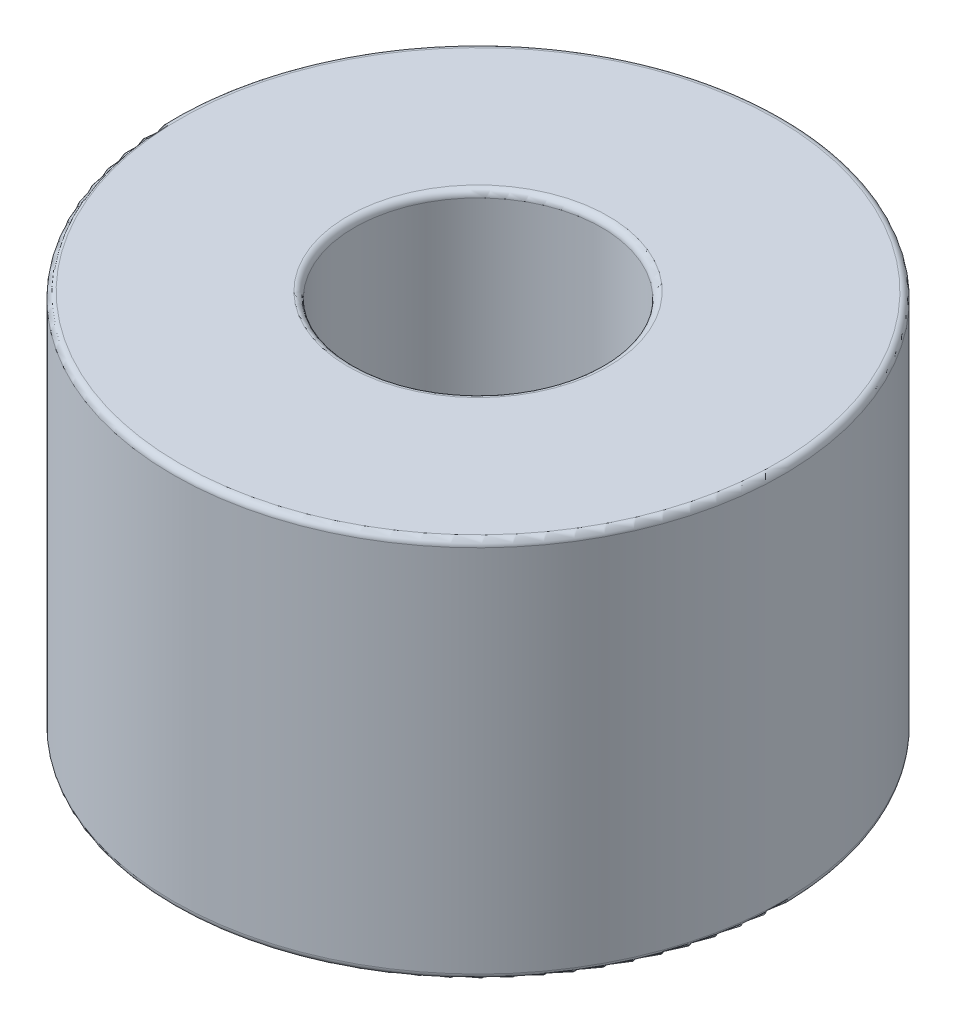
from build123d import *

# Parameters (mm, degrees)
SKETCH1_R           = 11.75
SKETCH1_R_2         = 4.765
BOSS_EXTRUDE1_DEPTH = 14.732
FILLET1_R           = 0.254


with BuildPart() as part:
    # Sketch1 → Boss-Extrude1 (new body)
    with BuildSketch(Plane(origin=(0, 0, 0), x_dir=(1, 0, 0), z_dir=(0, 1, 0))):
        Circle(SKETCH1_R)
        Circle(SKETCH1_R_2, mode=Mode.SUBTRACT)
    extrude(amount=BOSS_EXTRUDE1_DEPTH)

    # Fillet1
    fillet1_edges = [part.edges().sort_by_distance(p)[0] for p in [
        (-4.765, 14.732, 0),
        (-11.75, 14.732, 0),
        (-4.765, 0, 0),
        (-11.75, 0, 0),
    ]]
    fillet(fillet1_edges, radius=FILLET1_R)


solid = part.part
